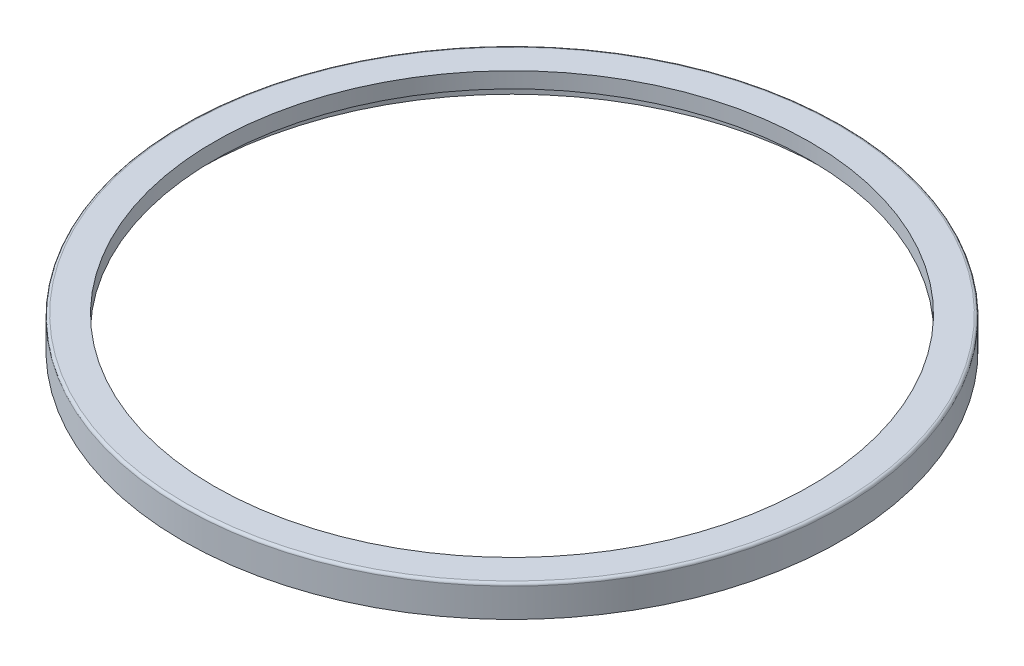
from build123d import *

# Parameters (mm, degrees)
FILLET1_R = 1.5875
FILLET2_R = 0.508


with BuildPart() as part:
    # Sketch1 → Revolve1 (revolve)
    with BuildSketch(Plane.XY):
        Polygon((-57.7215, 0), (-63.8175, 0), (-63.8175, -6.096), (-60.7695, -6.096), (-60.7695, -3.048), (-57.7215, -3.048), align=None)
    revolve(axis=Axis((0, 0, 0), (0, 1, 0)))

    # Fillet1
    fillet1_edges = [part.edges().sort_by_distance(p)[0] for p in [
        (60.7695, -3.048, 0),
    ]]
    fillet(fillet1_edges, radius=FILLET1_R)

    # Fillet2
    fillet2_edges = [part.edges().sort_by_distance(p)[0] for p in [
        (63.8175, 0, 0),
    ]]
    fillet(fillet2_edges, radius=FILLET2_R)


solid = part.part
